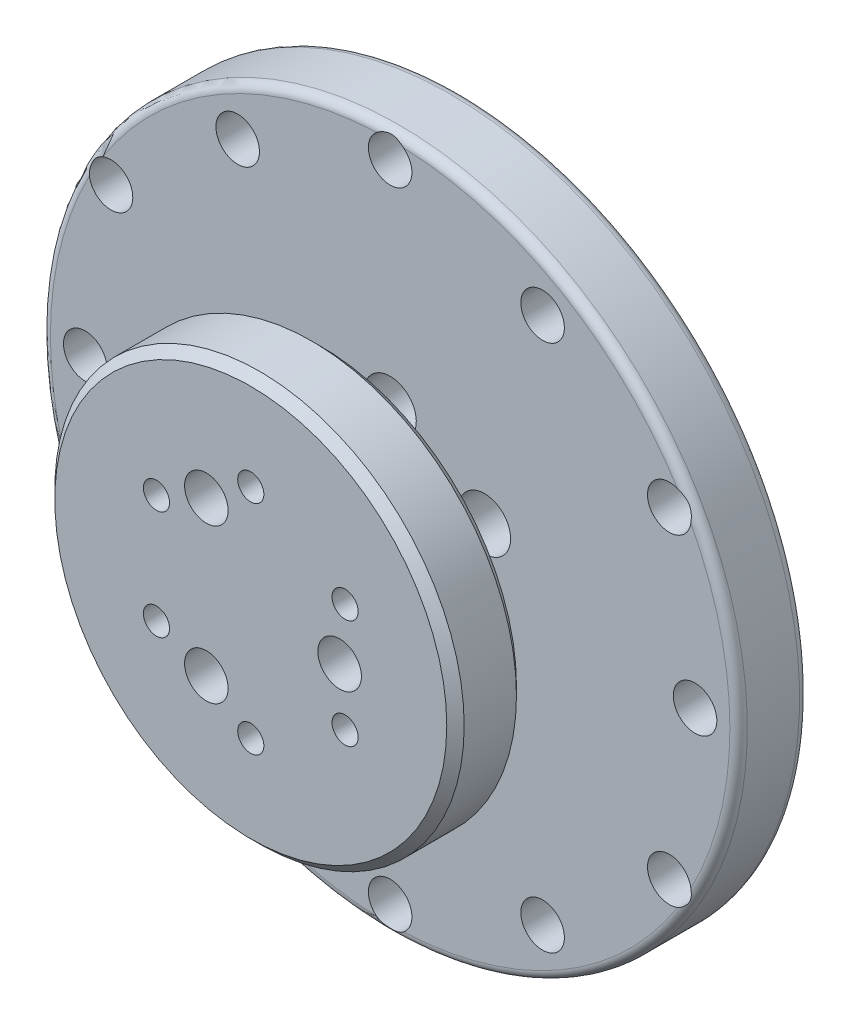
from build123d import *

# Parameters (mm, degrees)
SKETCH_1_R           = 23.5
EXTRUDE_3_DEPTH      = 8
SKETCH_2_R           = 0.75
CUT_EXTRUDE_1_DEPTH  = 22
SKETCH_3_R           = 1.5
CUT_EXTRUDE_2_DEPTH  = 22
SKETCH_4_R           = 1.5
CUT_EXTRUDE_3_DEPTH  = 22
SKETCH_6_R           = 1.5
CUT_EXTRUDE_4_DEPTH  = 22
SKETCH_7_R           = 1.5
CUT_EXTRUDE_5_DEPTH  = 22
SKETCH_8_R           = 1.5
CUT_EXTRUDE_6_DEPTH  = 22
SKETCH_9_R           = 1.5
CUT_EXTRUDE_7_DEPTH  = 22
SKETCH_12_R          = 2.75
CUT_EXTRUDE_9_DEPTH  = 3.1
SKETCH_14_W          = 0.501617195
SKETCH_14_H          = 0.723644477
EXTRUDE_4_DEPTH      = 3.1
SKETCH_15_R          = 0.546789956
CUT_EXTRUDE_10_DEPTH = 3.1
SKETCH_16_R          = 2.75
CUT_EXTRUDE_11_DEPTH = 3.1
SKETCH_17_R          = 2.75
CUT_EXTRUDE_12_DEPTH = 3.1
SKETCH_18_R          = 2.75
CUT_EXTRUDE_13_DEPTH = 3.1
SKETCH_19_R          = 2.75
CUT_EXTRUDE_14_DEPTH = 3.1
SKETCH_20_R          = 2.75
CUT_EXTRUDE_15_DEPTH = 3.1
SKETCH_21_R          = 2.5
CUT_EXTRUDE_17_DEPTH = 5
SKETCH_22_R          = 9.75
EXTRUDE_5_DEPTH      = 8
SKETCH_23_R          = 40
EXTRUDE_6_DEPTH      = 8
SKETCH_25_R          = 3
CUT_EXTRUDE_18_DEPTH = 10
SKETCH_26_R          = 2.5
CUT_EXTRUDE_19_DEPTH = 10
CHAMFER_1_SIZE       = 1
CHAMFER_2_SIZE       = 1
FILLET_1_R           = 1
FILLET_2_R           = 1


with BuildPart() as part:
    # 草图1 → 凸台-拉伸3 (new body)
    with BuildSketch(Plane.XY):
        Circle(SKETCH_1_R)
    extrude(amount=EXTRUDE_3_DEPTH)

    # 草图2 → 切除-拉伸1 (cut)
    with BuildSketch(Plane(origin=(0, 0, 0), x_dir=(-1, 0, 0), z_dir=(0, 0, -1))):
        with Locations((0, 12.5)):
            Circle(SKETCH_2_R)
        with Locations((10.825317547, 6.25)):
            Circle(SKETCH_2_R)
        with Locations((10.825317547, -6.25)):
            Circle(SKETCH_2_R)
        with Locations((0, -12.5)):
            Circle(SKETCH_2_R)
        with Locations((-10.825317547, -6.25)):
            Circle(SKETCH_2_R)
        with Locations((-10.825317547, 6.25)):
            Circle(SKETCH_2_R)
    extrude(amount=-CUT_EXTRUDE_1_DEPTH, mode=Mode.SUBTRACT)

    # 草图3 → 切除-拉伸2 (cut)
    with BuildSketch(Plane(origin=(0, 0, 0), x_dir=(-1, 0, 0), z_dir=(0, 0, -1))):
        with Locations((-10.825317547, 6.25)):
            Circle(SKETCH_3_R)
    extrude(amount=-CUT_EXTRUDE_2_DEPTH, mode=Mode.SUBTRACT)

    # 草图4 → 切除-拉伸3 (cut)
    with BuildSketch(Plane(origin=(0, 0, 0), x_dir=(-1, 0, 0), z_dir=(0, 0, -1))):
        with Locations((0, 12.5)):
            Circle(SKETCH_4_R)
    extrude(amount=-CUT_EXTRUDE_3_DEPTH, mode=Mode.SUBTRACT)

    # 草图6 → 切除-拉伸4 (cut)
    with BuildSketch(Plane(origin=(0, 0, 0), x_dir=(-1, 0, 0), z_dir=(0, 0, -1))):
        with Locations((10.825317547, 6.25)):
            Circle(SKETCH_6_R)
    extrude(amount=-CUT_EXTRUDE_4_DEPTH, mode=Mode.SUBTRACT)

    # 草图7 → 切除-拉伸5 (cut)
    with BuildSketch(Plane(origin=(0, 0, 0), x_dir=(-1, 0, 0), z_dir=(0, 0, -1))):
        with Locations((-10.825317547, -6.25)):
            Circle(SKETCH_7_R)
    extrude(amount=-CUT_EXTRUDE_5_DEPTH, mode=Mode.SUBTRACT)

    # 草图8 → 切除-拉伸6 (cut)
    with BuildSketch(Plane(origin=(0, 0, 0), x_dir=(-1, 0, 0), z_dir=(0, 0, -1))):
        with Locations((0, -12.5)):
            Circle(SKETCH_8_R)
    extrude(amount=-CUT_EXTRUDE_6_DEPTH, mode=Mode.SUBTRACT)

    # 草图9 → 切除-拉伸7 (cut)
    with BuildSketch(Plane(origin=(0, 0, 0), x_dir=(-1, 0, 0), z_dir=(0, 0, -1))):
        with Locations((10.825317547, -6.25)):
            Circle(SKETCH_9_R)
    extrude(amount=-CUT_EXTRUDE_7_DEPTH, mode=Mode.SUBTRACT)

    # 草图12 → 切除-拉伸9 (cut)
    with BuildSketch(Plane(origin=(0, 0, 0), x_dir=(-1, 0, 0), z_dir=(0, 0, -1))):
        with Locations((-10.825317547, 6.25)):
            Circle(SKETCH_12_R)
    extrude(amount=-CUT_EXTRUDE_9_DEPTH, mode=Mode.SUBTRACT)

    # 草图14 → 凸台-拉伸4 (add)
    with BuildSketch(Plane(origin=(0, 0, 3.1), x_dir=(-1, 0, 0), z_dir=(0, 0, -1))):
        with Locations((-12.614129252, 7.316642522)):
            Rectangle(SKETCH_14_W, SKETCH_14_H)
    extrude(amount=EXTRUDE_4_DEPTH)

    # 草图15 → 切除-拉伸10 (cut)
    with BuildSketch(Plane(origin=(0, 0, 0), x_dir=(-1, 0, 0), z_dir=(0, 0, -1))):
        with Locations((-12.623375944, 7.373337159)):
            Circle(SKETCH_15_R)
    extrude(amount=-CUT_EXTRUDE_10_DEPTH, mode=Mode.SUBTRACT)

    # 草图16 → 切除-拉伸11 (cut)
    with BuildSketch(Plane(origin=(0, 0, 0), x_dir=(-1, 0, 0), z_dir=(0, 0, -1))):
        with Locations((0, 12.5)):
            Circle(SKETCH_16_R)
    extrude(amount=-CUT_EXTRUDE_11_DEPTH, mode=Mode.SUBTRACT)

    # 草图17 → 切除-拉伸12 (cut)
    with BuildSketch(Plane(origin=(0, 0, 0), x_dir=(-1, 0, 0), z_dir=(0, 0, -1))):
        with Locations((10.825317547, 6.25)):
            Circle(SKETCH_17_R)
    extrude(amount=-CUT_EXTRUDE_12_DEPTH, mode=Mode.SUBTRACT)

    # 草图18 → 切除-拉伸13 (cut)
    with BuildSketch(Plane(origin=(0, 0, 0), x_dir=(-1, 0, 0), z_dir=(0, 0, -1))):
        with Locations((10.825317547, -6.25)):
            Circle(SKETCH_18_R)
    extrude(amount=-CUT_EXTRUDE_13_DEPTH, mode=Mode.SUBTRACT)

    # 草图19 → 切除-拉伸14 (cut)
    with BuildSketch(Plane(origin=(0, 0, 0), x_dir=(-1, 0, 0), z_dir=(0, 0, -1))):
        with Locations((0, -12.5)):
            Circle(SKETCH_19_R)
    extrude(amount=-CUT_EXTRUDE_14_DEPTH, mode=Mode.SUBTRACT)

    # 草图20 → 切除-拉伸15 (cut)
    with BuildSketch(Plane(origin=(0, 0, 0), x_dir=(-1, 0, 0), z_dir=(0, 0, -1))):
        with Locations((-10.825317547, -6.25)):
            Circle(SKETCH_20_R)
    extrude(amount=-CUT_EXTRUDE_15_DEPTH, mode=Mode.SUBTRACT)

    # 草图21 → 切除-拉伸17 (cut)
    with BuildSketch(Plane.XY.offset(8)):
        with Locations((10.2, 0)):
            Circle(SKETCH_21_R)
        with Locations((-5.1, 8.833459119)):
            Circle(SKETCH_21_R)
        with Locations((-5.1, -8.833459119)):
            Circle(SKETCH_21_R)
    extrude(amount=-CUT_EXTRUDE_17_DEPTH, mode=Mode.SUBTRACT)

    # 草图22 → 凸台-拉伸5 (add)
    with BuildSketch(Plane(origin=(0, 0, 0), x_dir=(-1, 0, 0), z_dir=(0, 0, -1))):
        with Locations(Location((0, 0, 0), (0, 0, 209.999878299))):
            Circle(SKETCH_22_R)
    extrude(amount=EXTRUDE_5_DEPTH)

    # 草图23 → 凸台-拉伸6 (add)
    with BuildSketch(Plane(origin=(0, 0, -8), x_dir=(-1, 0, 0), z_dir=(0, 0, -1))):
        Circle(SKETCH_23_R)
    extrude(amount=EXTRUDE_6_DEPTH)

    # 草图25 → 切除-拉伸18 (cut)
    with BuildSketch(Plane(origin=(0, 0, -16), x_dir=(-1, 0, 0), z_dir=(0, 0, -1))):
        with Locations((0, 12.5)):
            Circle(SKETCH_25_R)
        with Locations((0, -12.5)):
            Circle(SKETCH_25_R)
        with Locations((10.825317547, 6.25)):
            Circle(SKETCH_25_R)
        with Locations((10.825317547, -6.25)):
            Circle(SKETCH_25_R)
        with Locations((-10.825317547, 6.25)):
            Circle(SKETCH_25_R)
        with Locations((-10.825317547, -6.25)):
            Circle(SKETCH_25_R)
    extrude(amount=-CUT_EXTRUDE_18_DEPTH, mode=Mode.SUBTRACT)

    # 草图26 → 切除-拉伸19 (cut)
    with BuildSketch(Plane(origin=(0, 0, -16), x_dir=(-1, 0, 0), z_dir=(0, 0, -1))):
        with Locations((0, 37)):
            Circle(SKETCH_26_R)
        with Locations((17.5, 30.310889132)):
            Circle(SKETCH_26_R)
        with Locations((32.04293994, 18.5)):
            Circle(SKETCH_26_R)
        with Locations((35, 0)):
            Circle(SKETCH_26_R)
        with Locations((32.04293994, -18.5)):
            Circle(SKETCH_26_R)
        with Locations((17.5, -30.310889132)):
            Circle(SKETCH_26_R)
        with Locations((0, -37)):
            Circle(SKETCH_26_R)
        with Locations((-17.5, -30.310889132)):
            Circle(SKETCH_26_R)
        with Locations((-32.04293994, -18.5)):
            Circle(SKETCH_26_R)
        with Locations((-35, 0)):
            Circle(SKETCH_26_R)
        with Locations((-32.04293994, 18.5)):
            Circle(SKETCH_26_R)
        with Locations((-17.5, 30.310889132)):
            Circle(SKETCH_26_R)
    extrude(amount=-CUT_EXTRUDE_19_DEPTH, mode=Mode.SUBTRACT)

    # 倒角1
    chamfer_1_edges = [part.edges().sort_by_distance(p)[0] for p in [
        (-23.5, 0, 8),
    ]]
    chamfer(chamfer_1_edges, length=CHAMFER_1_SIZE)

    # 倒角2
    chamfer_2_edges = [part.edges().sort_by_distance(p)[0] for p in [
        (-23.5, 0, 0),
    ]]
    chamfer(chamfer_2_edges, length=CHAMFER_2_SIZE)

    # 圆角1
    # the kernel refuses this fillet: 1 mm, written as the material it takes off along each edge
    with BuildSketch(Plane(origin=(0, 0, -8), x_dir=(-1, 0, 0), z_dir=(0, -1, 0))) as fillet_1_piece_1:
        with BuildLine():
            CenterArc((40 - FILLET_1_R, FILLET_1_R), FILLET_1_R, 270, 90)
            Line((40, FILLET_1_R), (40, 0))
            Line((40, 0), (40 - FILLET_1_R, 0))
        make_face()
    revolve(axis=Axis((0, 0, -8), (0, 0, -1)), mode=Mode.SUBTRACT)

    # 圆角2
    # the kernel refuses this fillet: 1 mm, written as the material it takes off along each edge
    with BuildSketch(Plane(origin=(0, 0, -16), x_dir=(-1, 0, 0), z_dir=(0, -1, 0))) as fillet_2_piece_1:
        with BuildLine():
            CenterArc((40 - FILLET_2_R, -FILLET_2_R), FILLET_2_R, 0, 90)
            Line((40, -FILLET_2_R), (40, 0))
            Line((40, 0), (40 - FILLET_2_R, 0))
        make_face()
    revolve(axis=Axis((0, 0, -16), (0, 0, -1)), mode=Mode.SUBTRACT)


solid = part.part
